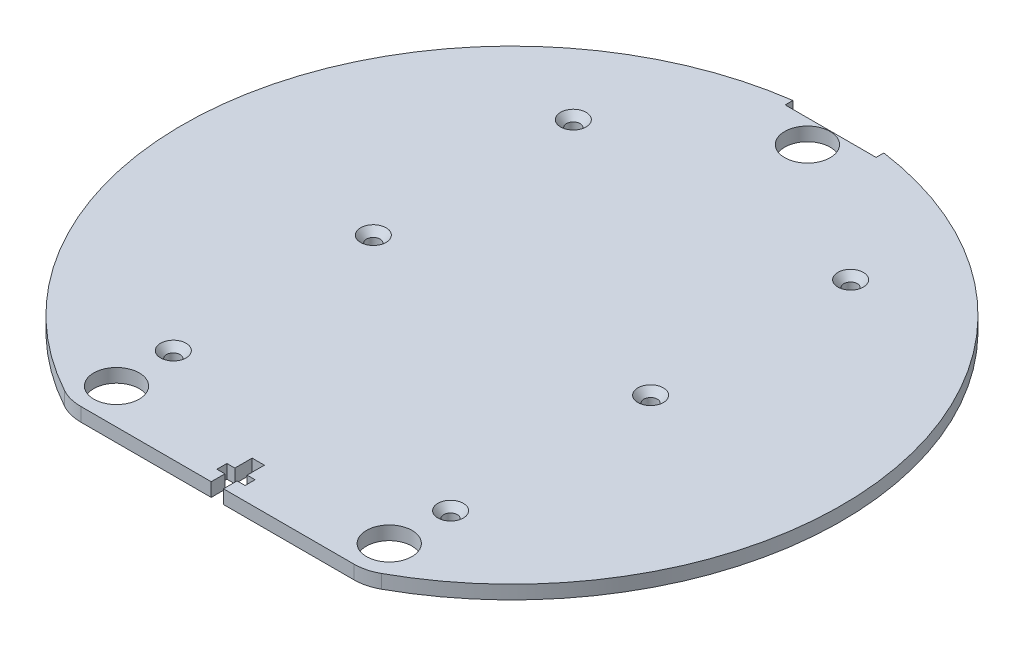
from build123d import *
from OCP.BRepFilletAPI import BRepFilletAPI_MakeChamfer

# Parameters (mm, degrees)
BOSS_EXTRUDE1_DEPTH = 3
SKETCH2_R           = 1.5
CUT_EXTRUDE1_DEPTH  = 103.574363269
CHAMFER1_SIZE       = 1.5
CHAMFER1_SIZE2      = 1.303930107
CUT_EXTRUDE2_DEPTH  = 103.574363269
SKETCH4_W           = 20
SKETCH4_H           = 1.7
CUT_EXTRUDE3_DEPTH  = 103.574363269
SKETCH5_R           = 5
CUT_EXTRUDE4_DEPTH  = 103.085748271


with BuildPart() as part:
    # Sketch1 → Boss-Extrude1 (new body)
    with BuildSketch(Plane(origin=(0, 0, 0), x_dir=(1, 0, 0), z_dir=(0, 1, 0))):
        with BuildLine():
            Line((30.029977361, -64.812867647), (-30.029977361, -64.812867647))
            ThreePointArc((-30.029977361, -64.812867647), (-32.509837414, -64.500503794), (-34.834773739, -63.582926471))
            ThreePointArc((-34.834773739, -63.582926471), (0, 72.5), (34.834773739, -63.582926471))
            ThreePointArc((34.834773739, -63.582926471), (32.509837414, -64.500503794), (30.029977361, -64.812867647))
        make_face()
    extrude(amount=BOSS_EXTRUDE1_DEPTH)

    # Sketch2 → Cut-Extrude1 (cut, through all)
    with BuildSketch(Plane(origin=(0, 3, 0), x_dir=(1, 0, 0), z_dir=(0, 1, 0))):
        with Locations((-30.5, 44)):
            Circle(SKETCH2_R)
        with Locations((30.5, 44)):
            Circle(SKETCH2_R)
        with Locations((30.5, 0)):
            Circle(SKETCH2_R)
        with Locations((30.5, -44)):
            Circle(SKETCH2_R)
        with Locations((-30.5, -44)):
            Circle(SKETCH2_R)
        with Locations((-30.5, 0)):
            Circle(SKETCH2_R)
    extrude(amount=-CUT_EXTRUDE1_DEPTH, mode=Mode.SUBTRACT)

    # Chamfer1: one chamfer whose edges measure the first distance from different faces: ONE call of the kernel's chamfer builder (chamfer() names one face for all edges)
    chamfer1_edges_1 = [part.edges().sort_by_distance(p)[0] for p in [
        (29, 3, -44),
    ]]
    chamfer1_side_1 = [part.faces().sort_by_distance(p)[0] for p in [
        (29, 1.5, -44),
    ]]
    chamfer1_edges_2 = [part.edges().sort_by_distance(p)[0] for p in [
        (29, 3, 0),
    ]]
    chamfer1_side_2 = [part.faces().sort_by_distance(p)[0] for p in [
        (29, 1.5, 0),
    ]]
    chamfer1_edges_3 = [part.edges().sort_by_distance(p)[0] for p in [
        (29, 3, 44),
    ]]
    chamfer1_side_3 = [part.faces().sort_by_distance(p)[0] for p in [
        (29, 1.5, 44),
    ]]
    chamfer1_edges_4 = [part.edges().sort_by_distance(p)[0] for p in [
        (-32, 3, 44),
    ]]
    chamfer1_side_4 = [part.faces().sort_by_distance(p)[0] for p in [
        (-32, 1.5, 44),
    ]]
    chamfer1_edges_5 = [part.edges().sort_by_distance(p)[0] for p in [
        (-32, 3, 0),
    ]]
    chamfer1_side_5 = [part.faces().sort_by_distance(p)[0] for p in [
        (-32, 1.5, 0),
    ]]
    chamfer1_edges_6 = [part.edges().sort_by_distance(p)[0] for p in [
        (-32, 3, -44),
    ]]
    chamfer1_side_6 = [part.faces().sort_by_distance(p)[0] for p in [
        (-32, 1.5, -44),
    ]]
    chamfer1 = BRepFilletAPI_MakeChamfer(part.part.solid().wrapped)
    for e in chamfer1_edges_1:
        chamfer1.Add(CHAMFER1_SIZE, CHAMFER1_SIZE2, e.wrapped, chamfer1_side_1[0].wrapped)  # the first distance lies on this face
    for e in chamfer1_edges_2:
        chamfer1.Add(CHAMFER1_SIZE, CHAMFER1_SIZE2, e.wrapped, chamfer1_side_2[0].wrapped)  # the first distance lies on this face
    for e in chamfer1_edges_3:
        chamfer1.Add(CHAMFER1_SIZE, CHAMFER1_SIZE2, e.wrapped, chamfer1_side_3[0].wrapped)  # the first distance lies on this face
    for e in chamfer1_edges_4:
        chamfer1.Add(CHAMFER1_SIZE, CHAMFER1_SIZE2, e.wrapped, chamfer1_side_4[0].wrapped)  # the first distance lies on this face
    for e in chamfer1_edges_5:
        chamfer1.Add(CHAMFER1_SIZE, CHAMFER1_SIZE2, e.wrapped, chamfer1_side_5[0].wrapped)  # the first distance lies on this face
    for e in chamfer1_edges_6:
        chamfer1.Add(CHAMFER1_SIZE, CHAMFER1_SIZE2, e.wrapped, chamfer1_side_6[0].wrapped)  # the first distance lies on this face
    add(Compound.cast(chamfer1.Shape()), mode=Mode.REPLACE)

    # Sketch3 → Cut-Extrude2 (cut, through all)
    with BuildSketch(Plane(origin=(0, 3, 0), x_dir=(1, 0, 0), z_dir=(0, 1, 0))):
        Polygon((1.35, -61.812867647), (3.1, -61.812867647), (3.1, -59.612867647), (1.35, -59.612867647), (1.35, -55.812867647), (-1.35, -55.812867647), (-1.35, -59.612867647), (-3.1, -59.612867647), (-3.1, -61.812867647), (-1.35, -61.812867647), (-1.35, -64.812867647), (1.35, -64.812867647), align=None)
    extrude(amount=-CUT_EXTRUDE2_DEPTH, mode=Mode.SUBTRACT)

    # Sketch4 → Cut-Extrude3 (cut, through all)
    with BuildSketch(Plane(origin=(0, 3, 0), x_dir=(1, 0, 0), z_dir=(0, 1, 0))):
        with Locations((0, 70.957033082)):
            Rectangle(SKETCH4_W, SKETCH4_H)
    extrude(amount=-CUT_EXTRUDE3_DEPTH, mode=Mode.SUBTRACT)


with BuildPart() as body_2:
    # of the pieces the cut leaves, the one that is kept (cut_extrude3_keep)
    add(part.part.solids().sort_by_distance((-30.029977361, 3, 64.812867647))[0])

    # Sketch5 → Cut-Extrude4 (cut, through all)
    with BuildSketch(Plane(origin=(0, 3, 0), x_dir=(1, 0, 0), z_dir=(0, 1, 0))):
        with Locations((0, 65)):
            Circle(SKETCH5_R)
        with Locations((30, -57)):
            Circle(SKETCH5_R)
        with Locations((-30, -57)):
            Circle(SKETCH5_R)
    extrude(amount=-CUT_EXTRUDE4_DEPTH, mode=Mode.SUBTRACT)


solid = body_2.part
